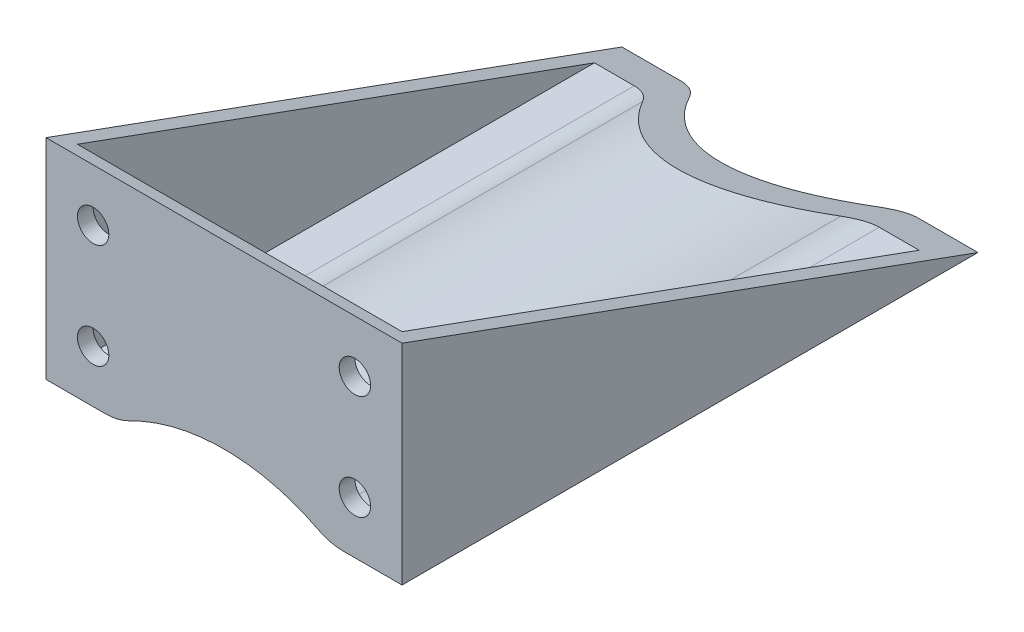
from build123d import *

# Parameters (mm, degrees)
SALIENTE_EXTRUIR3_DEPTH = 34
CROQUIS6_R              = 19.75
CORTAR_EXTRUIR2_DEPTH   = 68.683085036
VACIADO3_T              = -1.5
CROQUIS5_R              = 1.5
CORTAR_EXTRUIR3_DEPTH   = 10
REDONDEO1_R             = 5
REDONDEO3_R             = 5


with BuildPart() as part:
    # Croquis4 → Saliente-Extruir3 (new body)
    with BuildSketch(Plane(origin=(0, 0, 0), x_dir=(0, 0, -1), z_dir=(1, 0, 0))):
        Polygon((0, 0), (55, 0), (0, 20), align=None)
    extrude(amount=SALIENTE_EXTRUIR3_DEPTH)

    # Croquis6 → Cortar-Extruir2 (cut, through all)
    with BuildSketch(Plane.XY):
        with Locations((17, -17)):
            Circle(CROQUIS6_R)
    extrude(amount=-CORTAR_EXTRUIR2_DEPTH, mode=Mode.SUBTRACT)

    # Vaciado3
    vaciado3_openings = [part.faces().sort_by_distance(p)[0] for p in [
        (17, 10.517691614, -26.076348062),
    ]]
    offset(amount=VACIADO3_T, openings=vaciado3_openings, kind=Kind.INTERSECTION)

    # Croquis5 → Cortar-Extruir3 (cut)
    with BuildSketch(Plane.XY):
        with Locations((4.5, 15)):
            Circle(CROQUIS5_R)
        with Locations((29.5, 15)):
            Circle(CROQUIS5_R)
        with Locations((29.5, 5)):
            Circle(CROQUIS5_R)
        with Locations((4.5, 5)):
            Circle(CROQUIS5_R)
    extrude(amount=-CORTAR_EXTRUIR3_DEPTH, mode=Mode.SUBTRACT)

    # Redondeo1
    redondeo1_edges = [part.edges().sort_by_distance(p)[0] for p in [
        (6.947015369, 0, -27.5),
        (27.052984631, 0, -27.5),
    ]]
    fillet(redondeo1_edges, radius=REDONDEO1_R)

    # Redondeo3
    redondeo3_edges = [part.edges().sort_by_distance(p)[0] for p in [
        (27.455261833, 1.5, -26.1875),
        (6.544738167, 1.5, -26.187500003),
    ]]
    fillet(redondeo3_edges, radius=REDONDEO3_R)


solid = part.part
